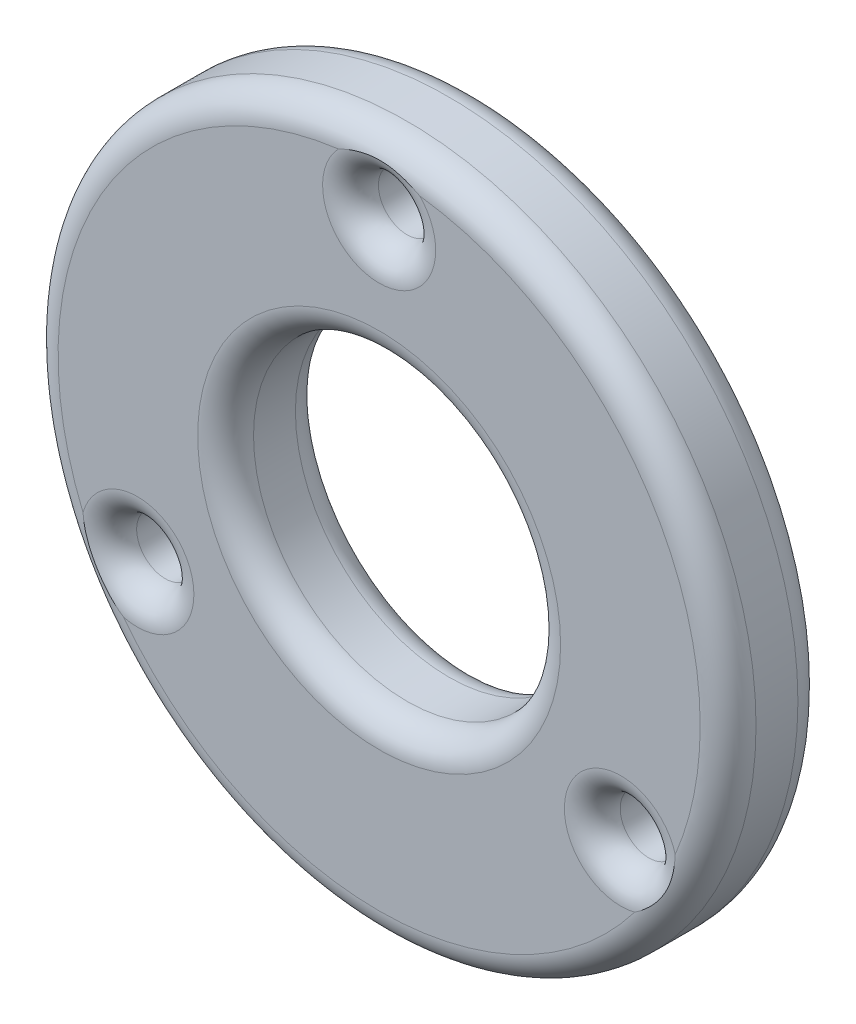
from build123d import *

# Parameters (mm, degrees)
SKETCH_1_R      = 25
SKETCH_1_R_2    = 11
SKETCH_1_R_3    = 2.05
EXTRUDE_1_DEPTH = 3.5
FILLET_1_R      = 2


with BuildPart() as part:
    # 草图1 → 凸台-拉伸1 (new, symmetric)
    with BuildSketch(Plane.XY):
        with Locations((0, 90)):
            Circle(SKETCH_1_R)
        with Locations((0, 90)):
            Circle(SKETCH_1_R_2, mode=Mode.SUBTRACT)
        with Locations((0, 110)):
            Circle(SKETCH_1_R_3, mode=Mode.SUBTRACT)
        with Locations((17.320508076, 80)):
            Circle(SKETCH_1_R_3, mode=Mode.SUBTRACT)
        with Locations((-17.320508076, 80)):
            Circle(SKETCH_1_R_3, mode=Mode.SUBTRACT)
    extrude(amount=EXTRUDE_1_DEPTH, both=True)

    # 圆角1
    # the kernel refuses this fillet: 2 mm, written as the material it takes off along each edge
    with BuildSketch(Plane(origin=(-17.320508076, 80, 3.5), x_dir=(1, 0, 0), z_dir=(0, -1, 0))) as fillet_1_piece_1:
        with BuildLine():
            CenterArc((2.05 + FILLET_1_R, -FILLET_1_R), FILLET_1_R, 90, 90)
            Line((2.05, -FILLET_1_R), (2.05, 0))
            Line((2.05, 0), (2.05 + FILLET_1_R, 0))
        make_face()
    revolve(axis=Axis((-17.320508076, 80, 3.5), (0, 0, 1)), mode=Mode.SUBTRACT)
    with BuildSketch(Plane(origin=(17.320508076, 80, 3.5), x_dir=(1, 0, 0), z_dir=(0, -1, 0))) as fillet_1_piece_2:
        with BuildLine():
            CenterArc((2.05 + FILLET_1_R, -FILLET_1_R), FILLET_1_R, 90, 90)
            Line((2.05, -FILLET_1_R), (2.05, 0))
            Line((2.05, 0), (2.05 + FILLET_1_R, 0))
        make_face()
    revolve(axis=Axis((17.320508076, 80, 3.5), (0, 0, 1)), mode=Mode.SUBTRACT)
    with BuildSketch(Plane(origin=(0, 110, 3.5), x_dir=(1, 0, 0), z_dir=(0, -1, 0))) as fillet_1_piece_3:
        with BuildLine():
            CenterArc((2.05 + FILLET_1_R, -FILLET_1_R), FILLET_1_R, 90, 90)
            Line((2.05, -FILLET_1_R), (2.05, 0))
            Line((2.05, 0), (2.05 + FILLET_1_R, 0))
        make_face()
    revolve(axis=Axis((0, 110, 3.5), (0, 0, 1)), mode=Mode.SUBTRACT)
    with BuildSketch(Plane(origin=(0, 90, 3.5), x_dir=(1, 0, 0), z_dir=(0, -1, 0))) as fillet_1_piece_4:
        with BuildLine():
            CenterArc((25 - FILLET_1_R, -FILLET_1_R), FILLET_1_R, 0, 90)
            Line((25 - FILLET_1_R, 0), (25, 0))
            Line((25, 0), (25, -FILLET_1_R))
        make_face()
    revolve(axis=Axis((0, 90, 3.5), (0, 0, 1)), mode=Mode.SUBTRACT)
    with BuildSketch(Plane(origin=(0, 90, -3.5), x_dir=(1, 0, 0), z_dir=(0, -1, 0))) as fillet_1_piece_5:
        with BuildLine():
            CenterArc((25 - FILLET_1_R, FILLET_1_R), FILLET_1_R, 270, 90)
            Line((25 - FILLET_1_R, 0), (25, 0))
            Line((25, 0), (25, FILLET_1_R))
        make_face()
    revolve(axis=Axis((0, 90, -3.5), (0, 0, 1)), mode=Mode.SUBTRACT)
    with BuildSketch(Plane(origin=(0, 110, -3.5), x_dir=(1, 0, 0), z_dir=(0, -1, 0))) as fillet_1_piece_6:
        with BuildLine():
            CenterArc((2.05 + FILLET_1_R, FILLET_1_R), FILLET_1_R, 180, 90)
            Line((2.05 + FILLET_1_R, 0), (2.05, 0))
            Line((2.05, 0), (2.05, FILLET_1_R))
        make_face()
    revolve(axis=Axis((0, 110, -3.5), (0, 0, 1)), mode=Mode.SUBTRACT)
    with BuildSketch(Plane(origin=(17.320508076, 80, -3.5), x_dir=(1, 0, 0), z_dir=(0, -1, 0))) as fillet_1_piece_7:
        with BuildLine():
            CenterArc((2.05 + FILLET_1_R, FILLET_1_R), FILLET_1_R, 180, 90)
            Line((2.05 + FILLET_1_R, 0), (2.05, 0))
            Line((2.05, 0), (2.05, FILLET_1_R))
        make_face()
    revolve(axis=Axis((17.320508076, 80, -3.5), (0, 0, 1)), mode=Mode.SUBTRACT)
    with BuildSketch(Plane(origin=(-17.320508076, 80, -3.5), x_dir=(1, 0, 0), z_dir=(0, -1, 0))) as fillet_1_piece_8:
        with BuildLine():
            CenterArc((2.05 + FILLET_1_R, FILLET_1_R), FILLET_1_R, 180, 90)
            Line((2.05 + FILLET_1_R, 0), (2.05, 0))
            Line((2.05, 0), (2.05, FILLET_1_R))
        make_face()
    revolve(axis=Axis((-17.320508076, 80, -3.5), (0, 0, 1)), mode=Mode.SUBTRACT)
    with BuildSketch(Plane(origin=(0, 90, -3.5), x_dir=(1, 0, 0), z_dir=(0, -1, 0))) as fillet_1_piece_9:
        with BuildLine():
            CenterArc((11 + FILLET_1_R, FILLET_1_R), FILLET_1_R, 180, 90)
            Line((11 + FILLET_1_R, 0), (11, 0))
            Line((11, 0), (11, FILLET_1_R))
        make_face()
    revolve(axis=Axis((0, 90, -3.5), (0, 0, 1)), mode=Mode.SUBTRACT)
    with BuildSketch(Plane(origin=(0, 90, 3.5), x_dir=(1, 0, 0), z_dir=(0, -1, 0))) as fillet_1_piece_10:
        with BuildLine():
            CenterArc((11 + FILLET_1_R, -FILLET_1_R), FILLET_1_R, 90, 90)
            Line((11, -FILLET_1_R), (11, 0))
            Line((11, 0), (11 + FILLET_1_R, 0))
        make_face()
    revolve(axis=Axis((0, 90, 3.5), (0, 0, 1)), mode=Mode.SUBTRACT)


solid = part.part
